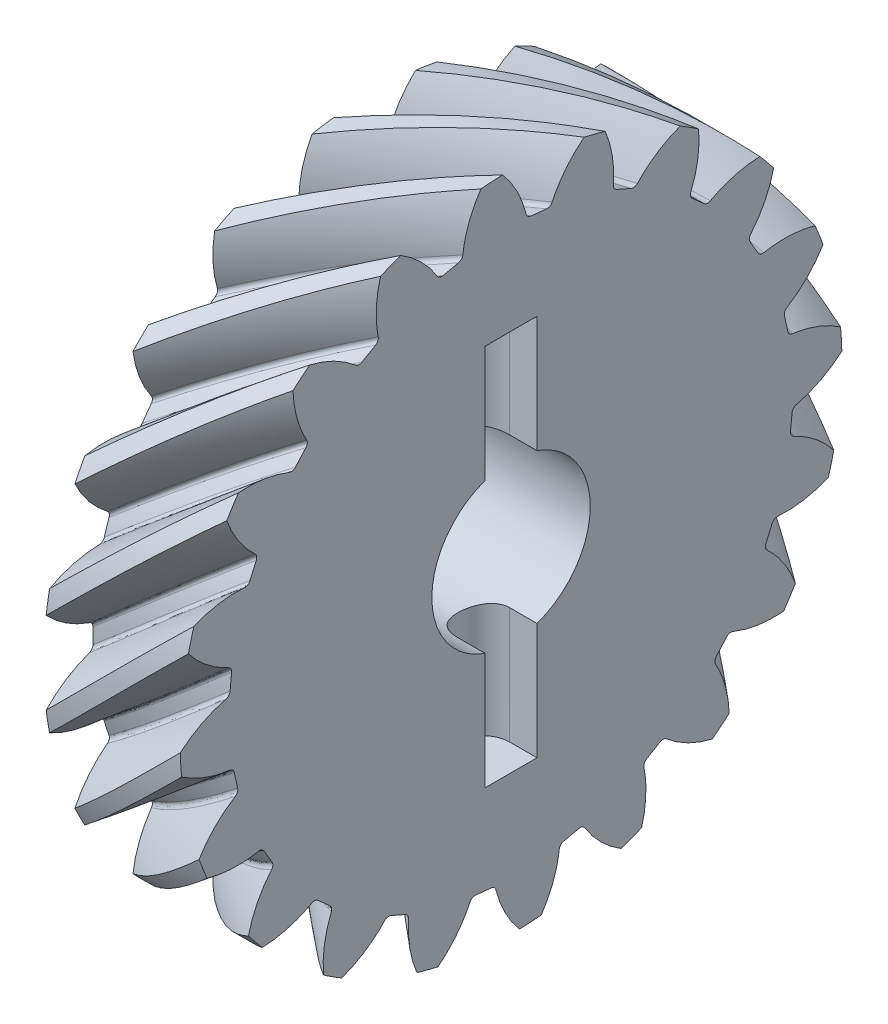
from build123d import *

# Parameters (mm, degrees)
BASPROSKE_W             = 5
BASPROSKE_H             = 12.113708499
TOOTHCUTLH_PITCH        = 76.112675256
TOOTHCUTLH_HEIGHT       = 5
TOOTHCUTLH_RADIUS       = 12.113708499
TOOTHCUTLH_START_ANGLE  = -90
TEETHCUTSLH_COUNT       = 20
TEETHCUTSLH_ANGLE       = 342
BORSKE_R                = 0.5
BORE_DEPTH              = 62.5000025
SKETCH5_R               = 2.9
CUT_EXTRUDE1_DEPTH      = 8
CUT_EXTRUDE2_DEPTH      = 7
CUT_EXTRUDE2_DEPTH_BACK = 7


with BuildPart() as part:
    # BasProSke → Base-Revolve (revolve)
    with BuildSketch(Plane(origin=(0, 0, 0), x_dir=(1, 0, 0), z_dir=(0, 1, 0)), mode=Mode.PRIVATE) as base_revolve_sk:
        with Locations((2.5, 6.05685425)):
            Rectangle(BASPROSKE_W, BASPROSKE_H)
    revolve(base_revolve_sk.sketch.rotate(Axis((-10, 0, 0), (1, 0, 0)), 180), axis=Axis((-10, 0, 0), (1, 0, 0)))

    # ToothCutLH: sweep along a helix
    with BuildLine() as toothcutlh_path:
        add(Helix(TOOTHCUTLH_PITCH, TOOTHCUTLH_HEIGHT, TOOTHCUTLH_RADIUS, center=(0, 0, 0), direction=(1, 0, 0), lefthand=True, mode=Mode.PRIVATE).rotate(Axis((0, 0, 0), (1, 0, 0)), TOOTHCUTLH_START_ANGLE))
    # TooCutSkeRH<3> → ToothCutLH (sweep, cut)
    with BuildSketch(Plane(origin=(0, 0, 0), x_dir=(0, 0, -1), z_dir=(1, 0, 0))):
        with BuildLine():
            ThreePointArc((0.283462707, 10.309812408), (0, 10.313708499), (-0.283462707, 10.309812408))
            ThreePointArc((-0.283462707, 10.309812408), (-0.402896237, 10.345129453), (-0.47859517, 10.444030076))
            ThreePointArc((-0.47859517, 10.444030076), (-1.035614295, 11.494681177), (-1.876899707, 12.335143487))
            ThreePointArc((-1.876899707, 12.335143487), (0, 12.477119754), (1.876899707, 12.335143487))
            ThreePointArc((1.876899707, 12.335143487), (1.035614295, 11.494681177), (0.47859517, 10.444030076))
            ThreePointArc((0.47859517, 10.444030076), (0.402896237, 10.345129453), (0.283462707, 10.309812408))
        make_face()
    toothcutlh = sweep(path=toothcutlh_path.line, is_frenet=True, mode=Mode.SUBTRACT)

    # TeethCutsLH: ToothCutLH ×20 about axis
    teethcutslh_axis = Axis((-10, 0, 0), (1, 0, 0))
    for i in range(1, TEETHCUTSLH_COUNT):
        add(toothcutlh.rotate(teethcutslh_axis, i * TEETHCUTSLH_ANGLE / (TEETHCUTSLH_COUNT - 1)), mode=Mode.SUBTRACT)

    # BorSke → Bore (cut, symmetric)
    with BuildSketch(Plane(origin=(0, 0, 0), x_dir=(0, 0, -1), z_dir=(1, 0, 0))):
        with Locations(Location((0, 0, 0), (0, 0, 180))):
            Circle(BORSKE_R)
    extrude(amount=BORE_DEPTH, both=True, mode=Mode.SUBTRACT)

    # Sketch5 → Cut-Extrude1 (cut)
    with BuildSketch(Plane(origin=(0, 0, 0), x_dir=(0, 0, -1), z_dir=(1, 0, 0))):
        with Locations(Location((0, 0, 0), (0, 0, 180))):
            Circle(SKETCH5_R)
    extrude(amount=CUT_EXTRUDE1_DEPTH, mode=Mode.SUBTRACT)

    # Sketch6 → Cut-Extrude2 (cut, two sides: drawn at the far end of the back side and taken through both)
    with BuildSketch(Plane(origin=(0, 0, 0), x_dir=(1, 0, 0), z_dir=(0, 1, 0)).offset(-CUT_EXTRUDE2_DEPTH_BACK)):
        with BuildLine():
            Line((4, 0.95), (5, 0.95))
            Line((5, 0.95), (5, -0.95))
            Line((5, -0.95), (4, -0.95))
            ThreePointArc((4, -0.95), (3.05, 0), (4, 0.95))
        make_face()
    extrude(amount=CUT_EXTRUDE2_DEPTH + CUT_EXTRUDE2_DEPTH_BACK, mode=Mode.SUBTRACT)


solid = part.part
